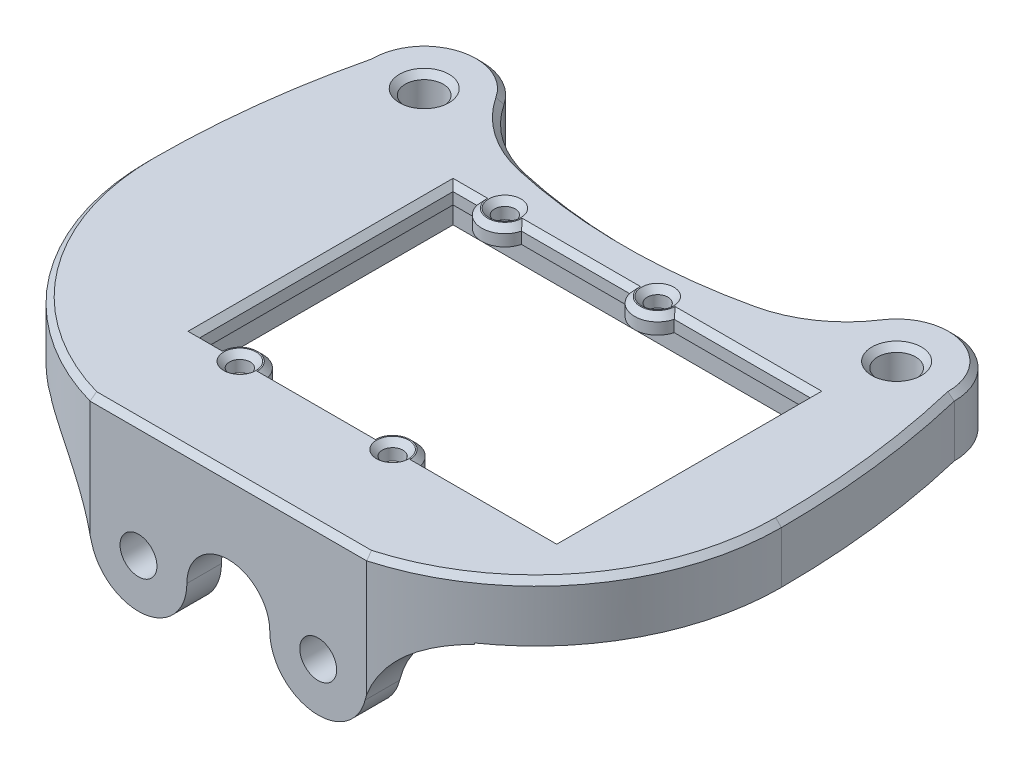
from build123d import *

# Parameters (mm, degrees)
COMPLETE_SKETCH_R               = 1.6
COMPLETE_SKETCH_R_2             = 1.65
BODY_DEPTH                      = 5
SMOOTHING_FILLET_R              = 10
CUT_EXTRUDE1_START              = -5
SKETCH1_R                       = 0.9
CUT_EXTRUDE1_DEPTH              = 5
CUT_EXTRUDE2_START              = -5
SKETCH1_4_W                     = 35
SKETCH1_4_H                     = 26
CUT_EXTRUDE2_DEPTH              = 3.5
ELEPHANTSFOOT_COMPENSATION_SIZE = 0.5
SKETCH5_R                       = 1.6
BOSS_EXTRUDE3_DEPTH             = 3
FILLET3_R                       = 8


with BuildPart() as part:
    # complete_sketch → body (new body)
    with BuildSketch(Plane(origin=(0, 0, 0), x_dir=(1, 0, 0), z_dir=(0, 1, 0))):
        with BuildLine():
            Line((0, -20.5), (24, -20.5))
            ThreePointArc((24, -20.5), (35.188838333, -12.850097276), (39.5, 0))
            ThreePointArc((39.5, 0), (38.998281767, 8.558621384), (37.5, 17))
            ThreePointArc((37.5, 17), (32.5, 22), (27.5, 17))
            ThreePointArc((27.5, 17), (12, 14.321592614), (-3.5, 17))
            ThreePointArc((-3.5, 17), (-8.5, 22), (-13.5, 17))
            ThreePointArc((-13.5, 17), (-14.998281767, 8.558621384), (-15.5, 0))
            ThreePointArc((-15.5, 0), (-11.188838333, -12.850097276), (0, -20.5))
        make_face()
        with Locations(Location((24, 0, 0), (0, 0, 270))):
            Circle(COMPLETE_SKETCH_R, mode=Mode.SUBTRACT)
        with Locations(Location((-8.5, 17, 0), (0, 0, 270))):
            Circle(COMPLETE_SKETCH_R_2, mode=Mode.SUBTRACT)
        with Locations(Location((32.5, 17, 0), (0, 0, 270))):
            Circle(COMPLETE_SKETCH_R_2, mode=Mode.SUBTRACT)
    extrude(amount=BODY_DEPTH)

    # smoothing_fillet
    smoothing_fillet_edges = [part.edges().sort_by_distance(p)[0] for p in [
        (-3.5, 2.5, -17),
        (27.5, 2.5, -17),
    ]]
    fillet(smoothing_fillet_edges, radius=SMOOTHING_FILLET_R)

    # Sketch1 → Cut-Extrude1 (cut)
    with BuildSketch(Plane(origin=(0, 5, 0), x_dir=(1, 0, 0), z_dir=(0, 1, 0)).offset(CUT_EXTRUDE1_START)):
        with BuildLine():
            Line((31, -11), (31, 11))
            Line((31, 11), (19.196491673, 11))
            ThreePointArc((19.196491673, 11), (17.26, 9.5), (15.323508327, 11))
            Line((15.323508327, 11), (5.936491673, 11))
            ThreePointArc((5.936491673, 11), (4, 9.5), (2.063508327, 11))
            Line((2.063508327, 11), (0, 11))
            Line((0, 11), (0, -11))
            Line((0, -11), (2.063508327, -11))
            ThreePointArc((2.063508327, -11), (4, -9.5), (5.936491673, -11))
            Line((5.936491673, -11), (15.323508327, -11))
            ThreePointArc((15.323508327, -11), (17.26, -9.5), (19.196491673, -11))
            Line((19.196491673, -11), (31, -11))
        make_face()
        with Locations(Location((4, 11.5, 0), (0, 0, 270))):
            Circle(SKETCH1_R)
        with Locations(Location((17.26, 11.5, 0), (0, 0, 270))):
            Circle(SKETCH1_R)
        with Locations(Location((17.26, -11.5, 0), (0, 0, 270))):
            Circle(SKETCH1_R)
        with Locations(Location((4, -11.5, 0), (0, 0, 270))):
            Circle(SKETCH1_R)
    extrude(amount=CUT_EXTRUDE1_DEPTH, mode=Mode.SUBTRACT)

    # Sketch1<4> → Cut-Extrude2 (cut)
    with BuildSketch(Plane(origin=(0, 5, 0), x_dir=(1, 0, 0), z_dir=(0, 1, 0)).offset(CUT_EXTRUDE2_START)):
        with Locations((15.5, 0)):
            Rectangle(SKETCH1_4_W, SKETCH1_4_H)
    extrude(amount=CUT_EXTRUDE2_DEPTH, mode=Mode.SUBTRACT)

    # elephantsfoot_compensation
    elephantsfoot_compensation_edges = [part.edges().sort_by_distance(p)[0] for p in [
        (33.926618039, 5, -21.792156192),
        (25.643793964, 5, -16.988490587),
        (38.998281767, 5, -8.558621384),
        (12, 5, -14.321592614),
        (35.188838333, 5, 12.850097276),
        (-1.643793964, 5, -16.988490587),
        (12, 5, 20.5),
        (-9.926618039, 5, -21.792156192),
        (-11.188838333, 5, 12.850097276),
        (-14.998281767, 5, -8.558621384),
        (4, 5, 10.6),
        (17.26, 5, 10.6),
        (17.26, 5, 9.5),
        (25.098245837, 5, 11),
        (31, 5, 0),
        (25.098245837, 5, -11),
        (17.26, 5, -9.5),
        (10.63, 5, -11),
        (4, 5, -9.5),
        (1.031754163, 5, -11),
        (0, 5, 0),
        (1.031754163, 5, 11),
        (4, 5, 9.5),
        (10.63, 5, 11),
        (-8.5, 5, -18.65),
        (4, 5, -12.4),
        (17.26, 5, -12.4),
        (32.5, 5, -18.65),
    ]]
    chamfer(elephantsfoot_compensation_edges, length=ELEPHANTSFOOT_COMPENSATION_SIZE)

    # Sketch5 → Boss-Extrude3 (add)
    with BuildSketch(Plane.XY.offset(20.5)):
        with BuildLine():
            Line((0, -5), (0, 0))
            Line((0, 0), (8.402527049, 0))
            Line((8.402527049, 0), (15.597472951, 0))
            Line((15.597472951, 0), (24, 0))
            Line((24, 0), (24, -5))
            ThreePointArc((24, -5), (19.798736476, -9.201263524), (15.597472951, -5))
            ThreePointArc((15.597472951, -5), (12, -1.402527049), (8.402527049, -5))
            ThreePointArc((8.402527049, -5), (4.201263524, -9.201263524), (0, -5))
        make_face()
        with Locations((4.201263524, -5)):
            Circle(SKETCH5_R, mode=Mode.SUBTRACT)
        with Locations(Location((19.798736476, -5, 0), (0, 0, 180))):
            Circle(SKETCH5_R, mode=Mode.SUBTRACT)
    extrude(amount=-BOSS_EXTRUDE3_DEPTH)

    # Fillet3
    # the kernel refuses this fillet: 8 mm, written as the material it adds along each edge
    with BuildSketch(Plane(origin=(0, 0, 20.5), x_dir=(-1, 0, 0), z_dir=(0, 0, -1))) as fillet3_piece_1_section:
        with BuildLine():
            CenterArc((7.625436421, -8), FILLET3_R, 90, 75.766381177)
            Line((-0.128973553, -6.032990604), (-0.90441455, -5.836289664))
            ThreePointArc((-0.90441455, -5.836289664), (-0.8, -5), (-0.8, 0))
            Line((-0.8, 0), (0, 0.8))
            Line((0, 0.8), (7.625436421, 0.8))
            Line((7.625436421, 0.8), (7.625436421, 0))
        make_face()
    fillet3_piece_1 = extrude(amount=3, mode=Mode.PRIVATE)
    fillet3_piece_1 = fillet3_piece_1 & Plane(origin=(5.806451613, -0.853747652, 0), x_dir=(-1, 0, 0), z_dir=(0, -1, 0)) * Cylinder(21.306451613, 37, mode=Mode.PRIVATE)
    add(fillet3_piece_1)
    with BuildSketch(Plane(origin=(24, 0, 20.5), x_dir=(1, 0, 0), z_dir=(0, 0, -1))) as fillet3_piece_2_section:
        with BuildLine():
            CenterArc((7.625436421, 8), FILLET3_R, 194.233618823, 75.766381177)
            Line((-0.128973553, 6.032990604), (-0.90441455, 5.836289664))
            ThreePointArc((-0.90441455, 5.836289664), (-0.8, 5), (-0.8, 0))
            Line((-0.8, 0), (0, -0.8))
            Line((0, -0.8), (7.625436421, -0.8))
            Line((7.625436421, -0.8), (7.625436421, 0))
        make_face()
    fillet3_piece_2 = extrude(amount=3, mode=Mode.PRIVATE)
    fillet3_piece_2 = fillet3_piece_2 & Plane(origin=(18.193548387, -2.088066401, 0), x_dir=(0.27252081756245267, 0, 0.9621498864496595), z_dir=(0, -1, 0)) * Cylinder(21.306451613, 37, mode=Mode.PRIVATE)
    add(fillet3_piece_2)


solid = part.part
